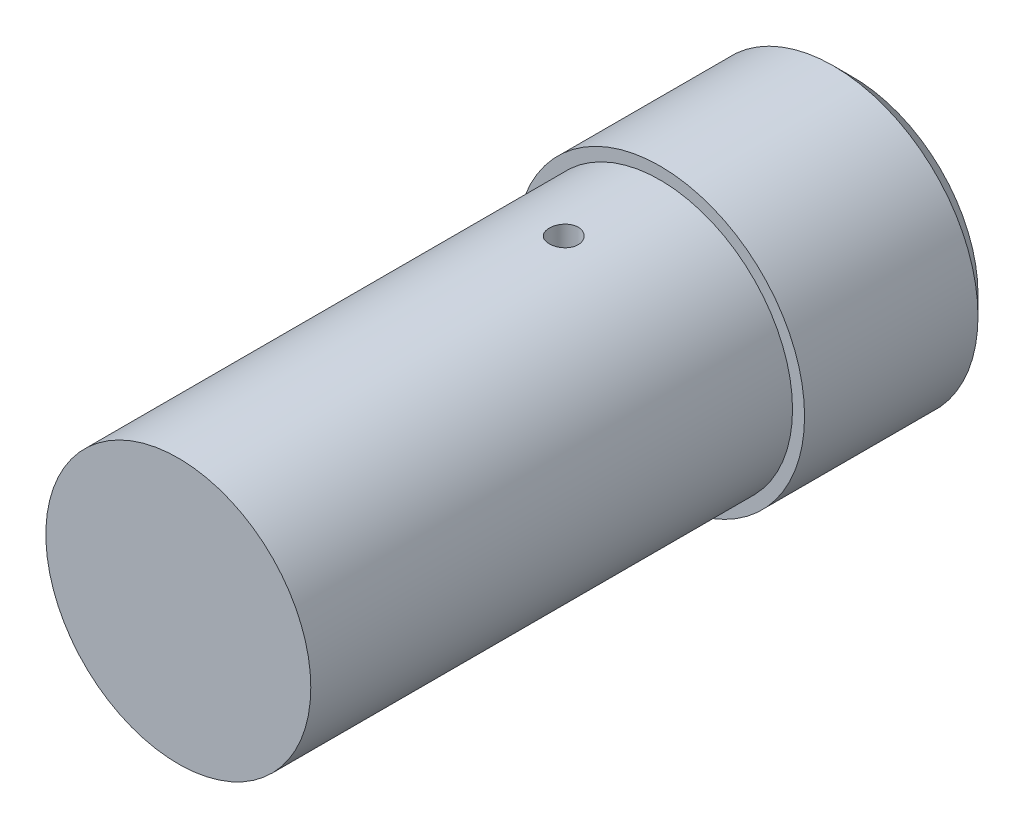
from build123d import *

# Parameters (mm, degrees)
ESQUISSE1_R             = 30
BASE_EXTRUSION_DEPTH    = 40
ESQUISSE2_R             = 27.5
BOSS_EXTRU_1_DEPTH      = 100
ESQUISSE3_R             = 3
ENL_V_MAT_EXTRU_1_DEPTH = 30
CHANFREIN1_SIZE         = 4


with BuildPart() as part:
    # Esquisse1 → Base-Extrusion (new body)
    with BuildSketch(Plane.XY):
        Circle(ESQUISSE1_R)
    extrude(amount=BASE_EXTRUSION_DEPTH)

    # Esquisse2 → Boss.-Extru.1 (add)
    with BuildSketch(Plane.XY.offset(40)):
        Circle(ESQUISSE2_R)
    extrude(amount=BOSS_EXTRU_1_DEPTH)

    # Esquisse3 → Enlèv. mat.-Extru.1 (cut)
    with BuildSketch(Plane(origin=(0, 30, 0), x_dir=(-1, 0, 0), z_dir=(0, 1, 0))):
        with Locations((0, 60)):
            Circle(ESQUISSE3_R)
    extrude(amount=-ENL_V_MAT_EXTRU_1_DEPTH, mode=Mode.SUBTRACT)

    # Chanfrein1
    chanfrein1_edges = [part.edges().sort_by_distance(p)[0] for p in [
        (-30, 0, 0),
    ]]
    chamfer(chanfrein1_edges, length=CHANFREIN1_SIZE)


solid = part.part
